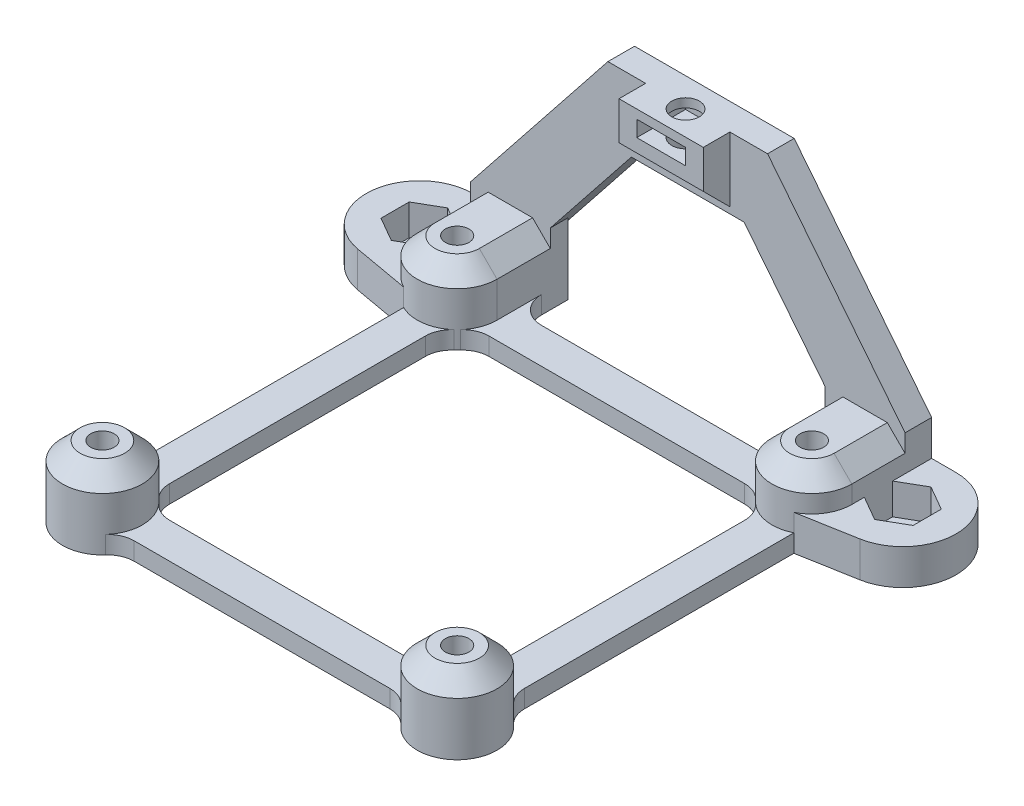
from build123d import *

# Parameters (mm, degrees)
SKETCH1_R             = 4.5
SKETCH1_R_2           = 1.325
BOSS_EXTRUDE1_DEPTH   = 8
BOSS_EXTRUDE1_2_DEPTH = 8
BOSS_EXTRUDE1_3_DEPTH = 8
BOSS_EXTRUDE1_4_DEPTH = 8
BOSS_EXTRUDE2_REACH   = 95.306
SKETCH2_W             = 3
SKETCH2_H             = 27.5
CUT_EXTRUDE1_DEPTH    = 63.503999872
SKETCH4_W             = 44
SKETCH4_H             = 44
SKETCH4_W_2           = 36
SKETCH4_H_2           = 36
BOSS_EXTRUDE3_DEPTH   = 2
SKETCH7_W             = 9.5
SKETCH7_H             = 3
BOSS_EXTRUDE5_DEPTH   = 4.3
CUT_EXTRUDE3_START    = -1
SKETCH8_W             = 5.5
SKETCH8_H             = 5.5
CUT_EXTRUDE3_DEPTH    = 1.8
CHAMFER3_SIZE         = 3
SKETCH9_R             = 1.55
CUT_EXTRUDE4_DEPTH    = 5.4
BOSS_EXTRUDE6_DEPTH   = 4
SKETCH11_R            = 1.5
BOSS_EXTRUDE7_DEPTH   = 0.5
FILLET2_R             = 3
CHAMFER4_SIZE         = 1
CHAMFER5_SIZE         = 2


with BuildPart() as part:
    # Sketch1 → Boss-Extrude1 (new body)
    with BuildSketch(Plane(origin=(0, 0, 0), x_dir=(1, 0, 0), z_dir=(0, 1, 0))):
        with Locations(Location((20, -74.5, 0), (0, 0, 270))):
            Circle(SKETCH1_R)
        with Locations(Location((20, -74.5, 0), (0, 0, 270))):
            Circle(SKETCH1_R_2, mode=Mode.SUBTRACT)
    extrude(amount=BOSS_EXTRUDE1_DEPTH)



with BuildPart() as body_2:
    # Sketch1 → Boss-Extrude1 2 (new body)
    with BuildSketch(Plane(origin=(0, 0, 0), x_dir=(1, 0, 0), z_dir=(0, 1, 0))):
        with Locations(Location((-20, -74.5, 0), (0, 0, 270))):
            Circle(SKETCH1_R)
        with Locations(Location((-20, -74.5, 0), (0, 0, 270))):
            Circle(SKETCH1_R_2, mode=Mode.SUBTRACT)
    extrude(amount=BOSS_EXTRUDE1_2_DEPTH)


with BuildPart() as body_3:
    # Sketch1 → Boss-Extrude1 3 (new body)
    with BuildSketch(Plane(origin=(0, 0, 0), x_dir=(1, 0, 0), z_dir=(0, 1, 0))):
        with BuildLine():
            Line((-24.5, -34.5), (-24.5, -25.5))
            Line((-24.5, -25.5), (-15.5, -25.5))
            Line((-15.5, -25.5), (-15.5, -34.5))
            ThreePointArc((-15.5, -34.5), (-20, -39), (-24.5, -34.5))
        make_face()
        with Locations(Location((-20, -34.5, 0), (0, 0, 270))):
            Circle(SKETCH1_R_2, mode=Mode.SUBTRACT)
    extrude(amount=BOSS_EXTRUDE1_3_DEPTH)

    # Boss-Extrude2: up to this face of the body (flat: up to its plane)
    boss_extrude2_end = Plane(body_3.part.faces().sort_by_distance((-24.5, 4, 30))[0])
    # Sketch2 → Boss-Extrude2 (add, up to the picked face)
    with BuildSketch(Plane(origin=(24.5, 0, 0), x_dir=(0, 0, -1), z_dir=(1, 0, 0)), mode=Mode.PRIVATE) as boss_extrude2_sk1:
        with Locations((-27, 13.75)):
            Rectangle(SKETCH2_W, SKETCH2_H)
    boss_extrude2_tool1 = split(extrude(boss_extrude2_sk1.sketch, amount=-BOSS_EXTRUDE2_REACH, mode=Mode.PRIVATE), bisect_by=boss_extrude2_end, keep=Keep.BOTH, mode=Mode.PRIVATE)


with BuildPart() as body_4:
    # Sketch1 → Boss-Extrude1 4 (new body)
    with BuildSketch(Plane(origin=(0, 0, 0), x_dir=(1, 0, 0), z_dir=(0, 1, 0))):
        with BuildLine():
            Line((24.5, -34.5), (24.5, -25.5))
            Line((24.5, -25.5), (15.5, -25.5))
            Line((15.5, -25.5), (15.5, -34.5))
            ThreePointArc((15.5, -34.5), (20, -39), (24.5, -34.5))
        make_face()
        with Locations(Location((20, -34.5, 0), (0, 0, 270))):
            Circle(SKETCH1_R_2, mode=Mode.SUBTRACT)
    extrude(amount=BOSS_EXTRUDE1_4_DEPTH)


with BuildPart() as body_3_1:
    add(body_3.part)

    add(body_4.part)  # Boss-Extrude2 merges body 4
    add(boss_extrude2_tool1.solids().sort_by(Axis((24.5, 13.75, 27), (-1, 0, 0)))[0])

    # Sketch3 → Cut-Extrude1 (cut, through all)
    with BuildSketch(Plane.XY.offset(28.5)):
        Polygon((-24.5, 8), (-9, 27.5), (-24.5, 27.5), align=None)
        Polygon((9, 27.5), (24.5, 8), (24.5, 27.5), align=None)
        Polygon((-15.5, 8), (-15.5, 0), (15.5, 0), (15.5, 8), (6.358974359, 19.5), (-6.358974359, 19.5), align=None)
    extrude(amount=-CUT_EXTRUDE1_DEPTH, mode=Mode.SUBTRACT)


with BuildPart() as part_1:
    add(part.part)

    add(body_2.part)  # Boss-Extrude3 merges body 2

    add(body_3_1.part)  # Boss-Extrude3 merges body 3
    # Sketch4 → Boss-Extrude3 (add)
    with BuildSketch(Plane.XZ):
        with Locations((0, 54.5)):
            Rectangle(SKETCH4_W, SKETCH4_H)
        with Locations((0, 54.5)):
            Rectangle(SKETCH4_W_2, SKETCH4_H_2, mode=Mode.SUBTRACT)
    extrude(amount=-BOSS_EXTRUDE3_DEPTH)

    # Sketch7 → Boss-Extrude5 (add)
    with BuildSketch(Plane(origin=(0, 27.5, 0), x_dir=(1, 0, 0), z_dir=(0, 1, 0))):
        with Locations((0, -30)):
            Rectangle(SKETCH7_W, SKETCH7_H)
    extrude(amount=-BOSS_EXTRUDE5_DEPTH)

    # Sketch8 → Cut-Extrude3 (cut)
    with BuildSketch(Plane(origin=(0, 27.5, 0), x_dir=(1, 0, 0), z_dir=(0, 1, 0)).offset(CUT_EXTRUDE3_START)):
        with Locations((0, -28.75)):
            Rectangle(SKETCH8_W, SKETCH8_H)
    extrude(amount=-CUT_EXTRUDE3_DEPTH, mode=Mode.SUBTRACT)

    # Chamfer3
    chamfer3_edges = [part_1.edges().sort_by_distance(p)[0] for p in [
        (0, 23.2, 28.5),
    ]]
    chamfer(chamfer3_edges, length=CHAMFER3_SIZE - 0.0001)  # a hair under: the kernel refuses the full size

    # Sketch9 → Cut-Extrude4 (cut)
    with BuildSketch(Plane(origin=(0, 27.5, 0), x_dir=(1, 0, 0), z_dir=(0, 1, 0))):
        with Locations(Location((0, -28.75, 0), (0, 0, 270))):
            Circle(SKETCH9_R)
    extrude(amount=-CUT_EXTRUDE4_DEPTH, mode=Mode.SUBTRACT)

    # Sketch10 → Boss-Extrude6 (add)
    with BuildSketch(Plane.XZ):
        with BuildLine():
            Line((-24.5, 25.5), (-27.25, 25.5))
            ThreePointArc((-27.25, 25.5), (-33.226647927, 30.971152617), (-28.303578206, 37.406773482))
            Line((-28.303578206, 37.406773482), (-22, 38.531128874))
            Line((-22, 38.531128874), (-22, 25.5))
            Line((-22, 25.5), (-24.5, 25.5))
        make_face()
        Polygon((-27.25, 28.324573519), (-24.5, 29.91228676), (-24.5, 33.08771324), (-27.25, 34.675426481), (-30, 33.08771324), (-30, 29.91228676), align=None, mode=Mode.SUBTRACT)
    boss_extrude6 = extrude(amount=-BOSS_EXTRUDE6_DEPTH)

    # Sketch11 → Boss-Extrude7 (add)
    with BuildSketch(Plane.XZ):
        Polygon((-30, 33.08771324), (-30, 29.91228676), (-27.25, 28.324573519), (-24.5, 29.91228676), (-24.5, 33.08771324), (-27.25, 34.675426481), align=None)
        with Locations(Location((-27.25, 31.5, 0), (0, 0, 270))):
            Circle(SKETCH11_R, mode=Mode.SUBTRACT)
    boss_extrude7 = extrude(amount=-BOSS_EXTRUDE7_DEPTH)

    # Mirror1: Boss-Extrude6, Boss-Extrude7 across plane
    add(boss_extrude6.mirror(Plane(origin=(0, 0, 0), x_dir=(0, 0, 1), z_dir=(1, 0, 0))))
    add(boss_extrude7.mirror(Plane(origin=(0, 0, 0), x_dir=(0, 0, 1), z_dir=(1, 0, 0))))

    # Fillet2
    fillet2_edges = [part_1.edges().sort_by_distance(p)[0] for p in [
        (15.968871126, 1, 76.5),
        (-18, 1, 70.468871126),
        (-15.968871126, 1, 76.5),
        (-22, 1, 70.468871126),
        (-15.968871126, 1, 72.5),
        (15.968871126, 1, 36.5),
        (-15.968871126, 1, 36.5),
        (15.5, 1, 32.5),
        (-15.5, 1, 32.5),
        (18, 1, 70.468871126),
        (-18, 1, 38.531128874),
        (22, 1, 70.468871126),
        (18, 1, 38.531128874),
        (15.968871126, 1, 72.5),
    ]]
    fillet(fillet2_edges, radius=FILLET2_R)

    # Chamfer4
    chamfer4_edges = [part_1.edges().sort_by_distance(p)[0] for p in [
        (15.5, 4, 25.5),
        (-15.5, 4, 25.5),
    ]]
    chamfer(chamfer4_edges, length=CHAMFER4_SIZE)

    # Chamfer5
    chamfer5_edges = [part_1.edges().sort_by_distance(p)[0] for p in [
        (20, 8, 70),
        (-20, 8, 70),
        (-24.5, 8, 31.5),
        (-20, 8, 39),
        (-15.5, 8, 31.5),
        (15.5, 8, 31.5),
        (20, 8, 39),
        (24.5, 8, 31.5),
    ]]
    chamfer(chamfer5_edges, length=CHAMFER5_SIZE)


solid = part_1.part
